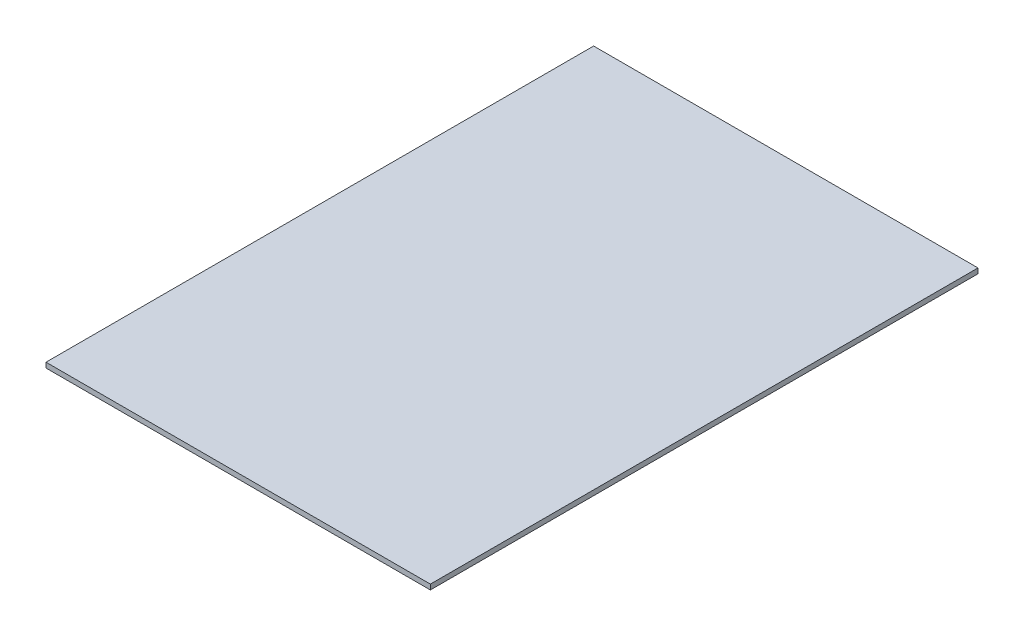
from build123d import *

# Parameters (mm, degrees)
SKETCH1_W           = 150.9
SKETCH1_H           = 215
BOSS_EXTRUDE1_DEPTH = 2


with BuildPart() as part:
    # Sketch1 → Boss-Extrude1 (new body)
    with BuildSketch(Plane(origin=(0, 0, 0), x_dir=(1, 0, 0), z_dir=(0, 1, 0))):
        with Locations((75.45, 107.5)):
            Rectangle(SKETCH1_W, SKETCH1_H)
    extrude(amount=BOSS_EXTRUDE1_DEPTH)


solid = part.part
